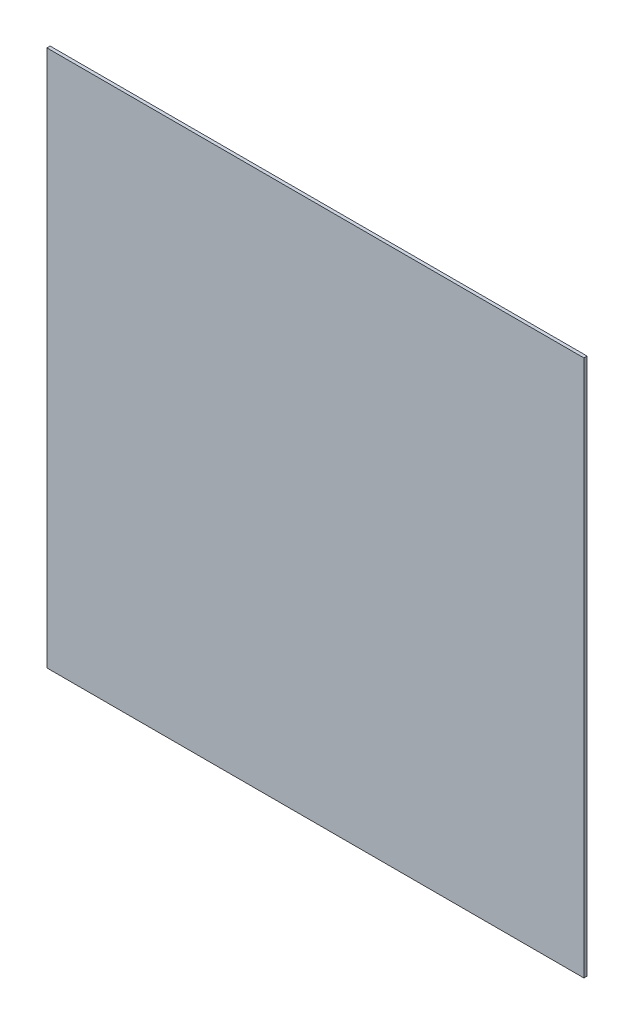
from build123d import *

# Parameters (mm, degrees)
SKETCH1_W           = 500
SKETCH1_H           = 500
BOSS_EXTRUDE1_DEPTH = 1.5


with BuildPart() as part:
    # Sketch1 → Boss-Extrude1 (new, symmetric)
    with BuildSketch(Plane.XY):
        Rectangle(SKETCH1_W, SKETCH1_H)
    extrude(amount=BOSS_EXTRUDE1_DEPTH, both=True)


solid = part.part
